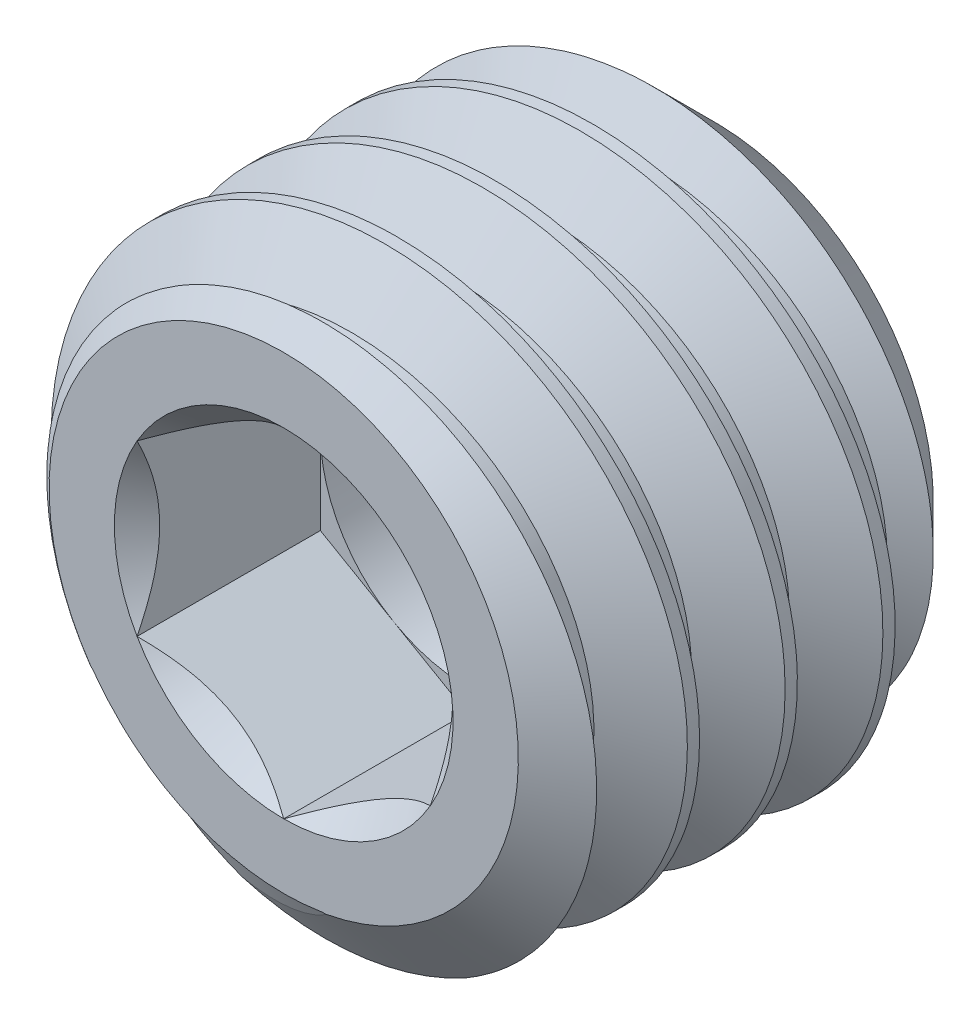
from build123d import *

# Parameters (mm, degrees)
CUT_SWEEP2_PITCH                         = 1.5875
CUT_EXTRUDE10_DEPTH                      = 2.9765625
F_3_16_0_1875_DIAMETER_HOLE1_D           = 4.7625
F_3_16_0_1875_DIAMETER_HOLE1_ON_FACE_2_D = 4.7625
SKETCH33_W                               = 1.502906059
SKETCH33_H                               = 5.894716256


with BuildPart() as part:
    # Sketch22 → Revolve1 (revolve)
    with BuildSketch(Plane(origin=(0, 0, 0), x_dir=(0, 0, -1), z_dir=(1, 0, 0)), mode=Mode.PRIVATE) as revolve1_sk:
        Polygon((-3.184722169, 0), (-3.184722169, 3.81), (-2.517774489, 4.7625), (2.599960697, 4.7625), (4.752777831, 2.609682866), (3.184722169, 0), align=None)
    revolve(revolve1_sk.sketch.rotate(Axis((0, 0, -3.184722169), (0, 0, -1)), 180), axis=Axis((0, 0, -3.184722169), (0, 0, -1)))

    # Cut-Sweep2: the profile of Sketch28 profile screwed along a right-hand helix of 6.8384 turns, 8 arcs to a turn; built about Z, then put on its axis
    cut_sweep2_z = Axis((0, 0, 0), (0, 0, 1))
    cut_sweep2_corners = [(0, 4.7628, 0.000173205), (0, 4.7628, -1.389235705), (0, 3.80012927, -0.8334375), (0, 3.80012927, -0.555625)]
    with BuildLine(mode=Mode.PRIVATE) as cut_sweep2_profile:
        Line(cut_sweep2_corners[0], cut_sweep2_corners[1])
        Line(cut_sweep2_corners[1], cut_sweep2_corners[2])
        Line(cut_sweep2_corners[2], cut_sweep2_corners[3])
        Line(cut_sweep2_corners[3], cut_sweep2_corners[0])
    cut_sweep2_cap = Face(cut_sweep2_profile.wire())
    cut_sweep2_turn_angles = [0, 22.5, 45, 67.5, 90, 112.5, 135, 157.5, 180, 202.5, 225, 247.5, 270, 292.5, 315, 337.5, 360]
    cut_sweep2_turn_weights = [1, 0.9238795325112867, 1, 0.9238795325112867, 1, 0.9238795325112867, 1, 0.9238795325112867, 1, 0.9238795325112867, 1, 0.9238795325112867, 1, 0.9238795325112867, 1, 0.9238795325112867, 1]
    cut_sweep2_turn_rails = [Edge.make_bspline([Vector(p[0], p[1], 0).rotate(cut_sweep2_z, cut_sweep2_turn_angles[k]) / cut_sweep2_turn_weights[k] + Vector(0, 0, p[2] + CUT_SWEEP2_PITCH * cut_sweep2_turn_angles[k] / 360) for k in range(17)], [0, 0, 0, 1, 1, 2, 2, 3, 3, 4, 4, 5, 5, 6, 6, 7, 7, 8, 8, 8], 2, cut_sweep2_turn_weights) for p in cut_sweep2_corners]
    cut_sweep2_turn_sides = [Face.make_surface_from_curves(cut_sweep2_turn_rails[p[0]], cut_sweep2_turn_rails[p[1]]) for p in [(0, 1), (1, 2), (2, 3), (3, 0)]]
    cut_sweep2_last_angles = [2160, 2182.5, 2205, 2227.5, 2250, 2272.5, 2295, 2317.5, 2340, 2362.5, 2385, 2407.5, 2430, 2445.912, 2461.824]
    cut_sweep2_last_weights = [1, 0.9238795325112867, 1, 0.9238795325112867, 1, 0.9238795325112867, 1, 0.9238795325112867, 1, 0.9238795325112867, 1, 0.9238795325112867, 1, 0.9616839105716721, 1]
    cut_sweep2_last_rails = [Edge.make_bspline([Vector(p[0], p[1], 0).rotate(cut_sweep2_z, cut_sweep2_last_angles[k]) / cut_sweep2_last_weights[k] + Vector(0, 0, p[2] + CUT_SWEEP2_PITCH * cut_sweep2_last_angles[k] / 360) for k in range(15)], [0, 0, 0, 1, 1, 2, 2, 3, 3, 4, 4, 5, 5, 6, 6, 7, 7, 7], 2, cut_sweep2_last_weights) for p in cut_sweep2_corners]
    cut_sweep2_last_sides = [Face.make_surface_from_curves(cut_sweep2_last_rails[p[0]], cut_sweep2_last_rails[p[1]]) for p in [(0, 1), (1, 2), (2, 3), (3, 0)]]
    cut_sweep2 = Plane(origin=(0, 0, -4.752777831), x_dir=(1, 0, 0), z_dir=(0, 0, 1)) * Solid(Shell([*[p.moved(Location((0, 0, CUT_SWEEP2_PITCH * i))) for i in range(6) for p in cut_sweep2_turn_sides], *cut_sweep2_last_sides, cut_sweep2_cap, cut_sweep2_cap.rotate(cut_sweep2_z, 2461.824).moved(Location((0, 0, CUT_SWEEP2_PITCH * 2461.824 / 360)))]))
    add(cut_sweep2, mode=Mode.SUBTRACT)

    # Sketch23 → Cut-Extrude10 (cut)
    with BuildSketch(Plane.XY.offset(3.184722169)):
        Polygon((0, 2.749630657), (-2.38125, 1.374815329), (-2.38125, -1.374815329), (0, -2.749630657), (2.38125, -1.374815329), (2.38125, 1.374815329), align=None)
    extrude(amount=-CUT_EXTRUDE10_DEPTH, mode=Mode.SUBTRACT)

    # Cut-Extrude11 cone 1 section (through the dimple's axis) → Cut-Extrude11 (revolve, cut)
    with BuildSketch(Plane(origin=(0, 0, 3.184722169), x_dir=(0, -1, 0), z_dir=(1, 0, 0))):
        Polygon((0, 0), (2.749630657, 0), (0, 2.749630657), align=None)
    revolve(axis=Axis((0, 0, 3.184722169), (0, 0, -1)), mode=Mode.SUBTRACT)

    # Cut-Extrude12 cone 1 section (through the dimple's axis) → Cut-Extrude12 (revolve, cut)
    with BuildSketch(Plane(origin=(0, 0, 0.208159669), x_dir=(0, -1, 0), z_dir=(1, 0, 0))):
        Polygon((0, 0), (2.38125, 0), (0, 1.374815329), align=None)
    revolve(axis=Axis((0, 0, 0.208159669), (0, 0, -1)), mode=Mode.SUBTRACT)

    # 3/16 (0.1875) Diameter Hole1 (through all)
    with Locations(Plane(origin=(0, 0, 3.184722169), x_dir=(0, 1, 0), z_dir=(0, 0, 1))):
        with Locations((0, 0)):
            Hole(F_3_16_0_1875_DIAMETER_HOLE1_D / 2)

    # 3/16 (0.1875) Diameter Hole1 on face 2 (through all)
    with Locations(Plane(origin=(0, 0, 0), x_dir=(0, 1, 0), z_dir=(0, 0, 1))):
        with Locations((0, 0)):
            Hole(F_3_16_0_1875_DIAMETER_HOLE1_ON_FACE_2_D / 2)

    # Sketch33 → Cut-Revolve1 (revolve, cut)
    with BuildSketch(Plane(origin=(0, 0, 0), x_dir=(0, 0, -1), z_dir=(1, 0, 0)), mode=Mode.PRIVATE) as cut_revolve1_sk:
        with Locations((4.561453029, 2.947358128)):
            Rectangle(SKETCH33_W, SKETCH33_H)
    revolve(cut_revolve1_sk.sketch.rotate(Axis((0, 0, 0), (0, 0, -1)), 232.014631226), axis=Axis((0, 0, 0), (0, 0, -1)), mode=Mode.SUBTRACT)


solid = part.part
